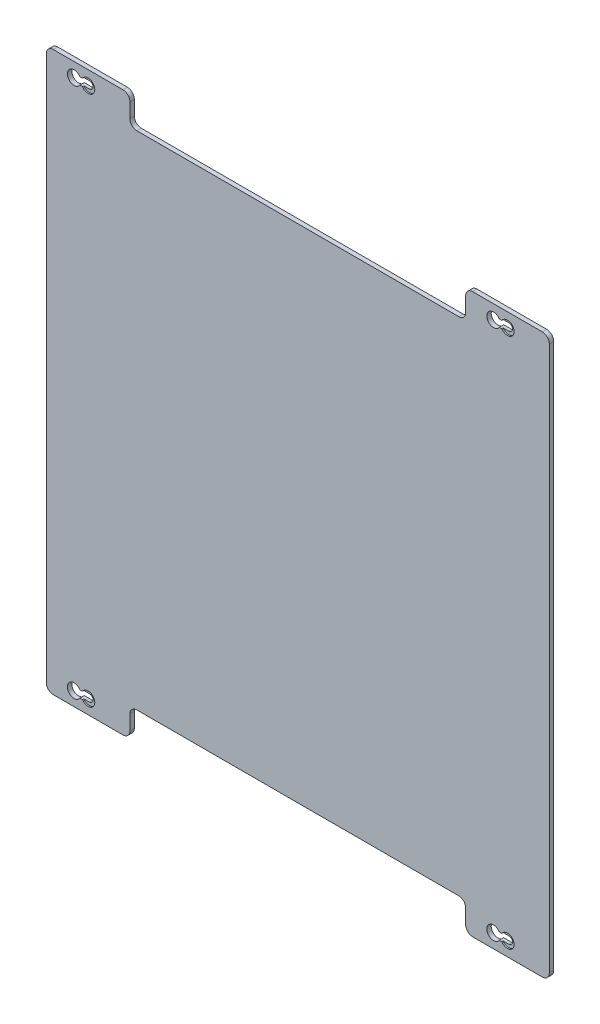
from build123d import *

# Parameters (mm, degrees)
BOSS_EXTRUDE1_DEPTH = 3.175
SKETCH2_R           = 4.8
CUT_EXTRUDE1_DEPTH  = 1


with BuildPart() as part:
    # Model → Boss-Extrude1 (new body)
    with BuildSketch(Plane.XY):
        with BuildLine():
            Line((175.500000042, 200.504864864), (125.500000042, 200.504864864))
            ThreePointArc((125.500000042, 200.504864864), (121.964466136, 199.04039877), (120.500000042, 195.504864864))
            Line((120.500000042, 195.504864864), (120.500000042, 185.00000269))
            ThreePointArc((120.500000042, 185.00000269), (119.035533948, 181.464468784), (115.500000042, 180.00000269))
            Line((115.500000042, 180.00000269), (-115.500000042, 180.00000269))
            ThreePointArc((-115.500000042, 180.00000269), (-119.035533948, 181.464468784), (-120.500000042, 185.00000269))
            Line((-120.500000042, 185.00000269), (-120.500000042, 195.504864864))
            ThreePointArc((-120.500000042, 195.504864864), (-121.964466136, 199.04039877), (-125.500000042, 200.504864864))
            Line((-125.500000042, 200.504864864), (-175.500000042, 200.504864864))
            ThreePointArc((-175.500000042, 200.504864864), (-179.035533948, 199.04039877), (-180.500000042, 195.504864864))
            Line((-180.500000042, 195.504864864), (-180.500000042, -195.504859484))
            ThreePointArc((-180.500000042, -195.504859484), (-179.035533948, -199.04039339), (-175.500000042, -200.504859484))
            Line((-175.500000042, -200.504859484), (-125.500000042, -200.504859484))
            ThreePointArc((-125.500000042, -200.504859484), (-121.964466136, -199.04039339), (-120.500000042, -195.504859484))
            Line((-120.500000042, -195.504859484), (-120.500000042, -184.99999731))
            ThreePointArc((-120.500000042, -184.99999731), (-119.035533948, -181.464463404), (-115.500000042, -179.99999731))
            Line((-115.500000042, -179.99999731), (115.500000042, -179.99999731))
            ThreePointArc((115.500000042, -179.99999731), (119.035533948, -181.464463404), (120.500000042, -184.99999731))
            Line((120.500000042, -184.99999731), (120.500000042, -195.504864864))
            ThreePointArc((120.500000042, -195.504864864), (121.964466136, -199.04039877), (125.500000042, -200.504864864))
            Line((125.500000042, -200.504864864), (175.500000042, -200.504864864))
            ThreePointArc((175.500000042, -200.504864864), (179.035533948, -199.04039877), (180.500000042, -195.504864864))
            Line((180.500000042, -195.504864864), (180.500000042, 195.504864864))
            ThreePointArc((180.500000042, 195.504864864), (179.035533948, 199.04039877), (175.500000042, 200.504864864))
        make_face()
        with BuildLine():
            Line((144.600753463, 187.915208316), (150.5, 187.915208316))
            ThreePointArc((150.5, 187.915208316), (153.089656548, 190.504864864), (150.5, 193.094521412))
            Line((150.5, 193.094521412), (144.600753463, 193.094521412))
            ThreePointArc((144.600753463, 193.094521412), (135.65, 190.504864864), (144.600753463, 187.915208316))
        make_face(mode=Mode.SUBTRACT)
        with BuildLine():
            Line((150.5, -187.905478588), (144.600753463, -187.905478588))
            ThreePointArc((144.600753463, -187.905478588), (135.65, -190.495135136), (144.600753463, -193.084791684))
            Line((144.600753463, -193.084791684), (150.5, -193.084791684))
            ThreePointArc((150.5, -193.084791684), (153.089656548, -190.495135136), (150.5, -187.905478588))
        make_face(mode=Mode.SUBTRACT)
        with BuildLine():
            Line((-150.5, -187.905478588), (-156.399246537, -187.905478588))
            ThreePointArc((-156.399246537, -187.905478588), (-165.35, -190.495135136), (-156.399246537, -193.084791684))
            Line((-156.399246537, -193.084791684), (-150.5, -193.084791684))
            ThreePointArc((-150.5, -193.084791684), (-147.910343452, -190.495135136), (-150.5, -187.905478588))
        make_face(mode=Mode.SUBTRACT)
        with BuildLine():
            Line((-150.5, 193.094521412), (-156.399246537, 193.094521412))
            ThreePointArc((-156.399246537, 193.094521412), (-165.35, 190.504864864), (-156.399246537, 187.915208316))
            Line((-156.399246537, 187.915208316), (-150.5, 187.915208316))
            ThreePointArc((-150.5, 187.915208316), (-147.910343452, 190.504864864), (-150.5, 193.094521412))
        make_face(mode=Mode.SUBTRACT)
    extrude(amount=BOSS_EXTRUDE1_DEPTH)

    # Sketch2 → Cut-Extrude1 (cut)
    with BuildSketch(Plane.XY.offset(3.175)):
        with Locations((-150.5, 190.504864864)):
            Circle(SKETCH2_R)
        with Locations((150.5, 190.504864864)):
            Circle(SKETCH2_R)
        with Locations((150.5, -190.495135136)):
            Circle(SKETCH2_R)
        with Locations((-150.5, -190.495135136)):
            Circle(SKETCH2_R)
    extrude(amount=-CUT_EXTRUDE1_DEPTH, mode=Mode.SUBTRACT)


solid = part.part
